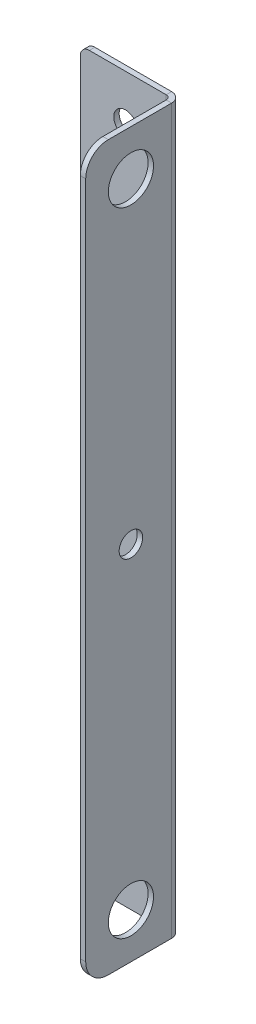
from build123d import *

# Parameters (mm, degrees)
SKETCH_1_R                   = 2.6
SM_BASE_FLANGE_1_DEPTH       = 1.2
SM_EDGE_FLANGE_2_DEPTH       = 160
SM_START                     = 1.2
SM_EDGE_FLANGE_2_PROFILE_R   = 5
SM_EDGE_FLANGE_2_PROFILE_R_2 = 2.6
SM_EDGE_FLANGE_2_FLAT_DEPTH  = 1.2


# Sheet-metal steps are written as plain solids
with BuildPart() as part:
    # Sketch 1 → 基体-法兰1 (new body)
    with BuildSketch(Plane.XY):
        with BuildLine():
            Line((-8, 80), (9, 80))
            Line((9, 80), (9, -80))
            Line((9, -80), (-8, -80))
            ThreePointArc((-8, -80), (-9.414213562, -79.414213562), (-10, -78))
            Line((-10, -78), (-10, 78))
            ThreePointArc((-10, 78), (-9.414213562, 79.414213562), (-8, 80))
        make_face()
        with Locations((0, 70)):
            Circle(SKETCH_1_R, mode=Mode.SUBTRACT)
        with Locations((0, -70)):
            Circle(SKETCH_1_R, mode=Mode.SUBTRACT)
    extrude(amount=-SM_BASE_FLANGE_1_DEPTH)

    # 边线-法兰2 bend section (across the edge) → 边线-法兰2 (add)
    with BuildSketch(Plane(origin=(10, -80, 0), x_dir=(-1, 0, 0), z_dir=(0, 1, 0))):
        with BuildLine():
            Line((-1.2, 1), (0, 1))
            ThreePointArc((0, 1), (0.292893219, 0.292893219), (1, 0))
            Line((1, 0), (1, -1.2))
            ThreePointArc((1, -1.2), (-0.555634919, -0.555634919), (-1.2, 1))
        make_face()
    extrude(amount=SM_EDGE_FLANGE_2_DEPTH)

    # 边线-法兰2 profile (on flange) → 边线-法兰2 flat (add)
    with BuildSketch(Plane.YZ.offset(10).offset(SM_START)):
        with BuildLine():
            Line((-80, 15), (-80, 1))
            Line((-80, 1), (80, 1))
            Line((80, 1), (80, 15))
            ThreePointArc((80, 15), (78.535533906, 18.535533906), (75, 20))
            Line((75, 20), (-75, 20))
            ThreePointArc((-75, 20), (-78.535533906, 18.535533906), (-80, 15))
        make_face()
        with Locations((-70, 10)):
            Circle(SM_EDGE_FLANGE_2_PROFILE_R, mode=Mode.SUBTRACT)
        with Locations((0, 10)):
            Circle(SM_EDGE_FLANGE_2_PROFILE_R_2, mode=Mode.SUBTRACT)
        with Locations((70, 10)):
            Circle(SM_EDGE_FLANGE_2_PROFILE_R, mode=Mode.SUBTRACT)
    extrude(amount=-SM_EDGE_FLANGE_2_FLAT_DEPTH)


solid = part.part
